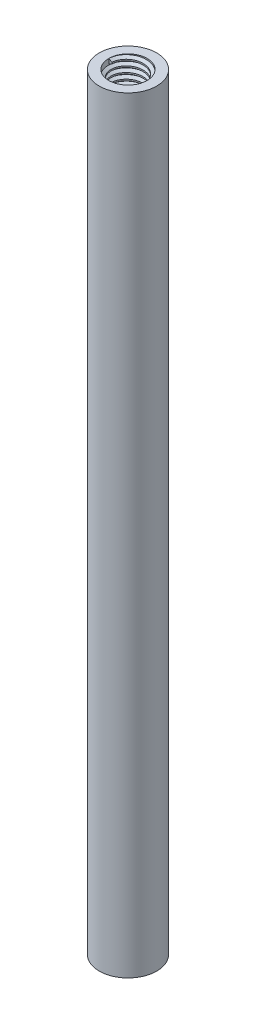
from build123d import *

# Parameters (mm, degrees)
SKETCH1_R           = 7.5
SKETCH1_R_2         = 5
BOSS_EXTRUDE1_DEPTH = 100
THREAD1_PITCH       = 1.5
THREAD2_PITCH       = 1.5


with BuildPart() as part:
    # Sketch1 → Boss-Extrude1 (new, symmetric)
    with BuildSketch(Plane(origin=(0, 0, 0), x_dir=(1, 0, 0), z_dir=(0, 1, 0))):
        with Locations(Location((0, 0, 0), (0, 0, 270))):
            Circle(SKETCH1_R)
        with Locations(Location((0, 0, 0), (0, 0, 270))):
            Circle(SKETCH1_R_2, mode=Mode.SUBTRACT)
    extrude(amount=BOSS_EXTRUDE1_DEPTH, both=True)

    # Thread1: arcs per turn and ends read off the stored shape
    # Thread1: the profile of Thread Profile1 profile screwed along a right-hand helix through 10 turns, 8 arcs to a turn; built about Z, then put on its axis
    thread1_z = Axis((0, 0, 0), (0, 0, 1))
    thread1_corners = [(5.0003, 0, -0.000173205), (5.0003, 0, 1.312673201), (4.188101187, 0, 0.843749998), (4.188101187, 0, 0.468749998)]
    with BuildLine(mode=Mode.PRIVATE) as thread1_profile:
        Line(thread1_corners[0], thread1_corners[1])
        Line(thread1_corners[1], thread1_corners[2])
        Line(thread1_corners[2], thread1_corners[3])
        Line(thread1_corners[3], thread1_corners[0])
    thread1_cap = Face(thread1_profile.wire())
    thread1_turn_angles = [0, 22.5, 45, 67.5, 90, 112.5, 135, 157.5, 180, 202.5, 225, 247.5, 270, 292.5, 315, 337.5, 360]
    thread1_turn_weights = [1, 0.9238795325112867, 1, 0.9238795325112867, 1, 0.9238795325112867, 1, 0.9238795325112867, 1, 0.9238795325112867, 1, 0.9238795325112867, 1, 0.9238795325112867, 1, 0.9238795325112867, 1]
    thread1_turn_rails = [Edge.make_bspline([Vector(p[0], p[1], 0).rotate(thread1_z, thread1_turn_angles[k]) / thread1_turn_weights[k] + Vector(0, 0, p[2] + THREAD1_PITCH * thread1_turn_angles[k] / 360) for k in range(17)], [0, 0, 0, 1, 1, 2, 2, 3, 3, 4, 4, 5, 5, 6, 6, 7, 7, 8, 8, 8], 2, thread1_turn_weights) for p in thread1_corners]
    thread1_turn_sides = [Face.make_surface_from_curves(thread1_turn_rails[p[0]], thread1_turn_rails[p[1]]) for p in [(0, 1), (1, 2), (2, 3), (3, 0)]]
    thread1 = Plane(origin=(0, 100, 0), x_dir=(-1, 0, 0), z_dir=(0, -1, 0)) * Solid(Shell([*[p.moved(Location((0, 0, THREAD1_PITCH * i))) for i in range(10) for p in thread1_turn_sides], thread1_cap, thread1_cap.rotate(thread1_z, 3600).moved(Location((0, 0, THREAD1_PITCH * 3600 / 360)))]))
    add(thread1)

    # Thread2: arcs per turn and ends read off the stored shape
    # Thread2: the profile of Thread Profile2 profile screwed along a right-hand helix through 10 turns, 8 arcs to a turn; built about Z, then put on its axis
    thread2_z = Axis((0, 0, 0), (0, 0, 1))
    thread2_corners = [(5.0003, 0, -0.000173205), (5.0003, 0, 1.312673201), (4.188101187, 0, 0.843749998), (4.188101187, 0, 0.468749998)]
    with BuildLine(mode=Mode.PRIVATE) as thread2_profile:
        Line(thread2_corners[0], thread2_corners[1])
        Line(thread2_corners[1], thread2_corners[2])
        Line(thread2_corners[2], thread2_corners[3])
        Line(thread2_corners[3], thread2_corners[0])
    thread2_cap = Face(thread2_profile.wire())
    thread2_turn_angles = [0, 22.5, 45, 67.5, 90, 112.5, 135, 157.5, 180, 202.5, 225, 247.5, 270, 292.5, 315, 337.5, 360]
    thread2_turn_weights = [1, 0.9238795325112867, 1, 0.9238795325112867, 1, 0.9238795325112867, 1, 0.9238795325112867, 1, 0.9238795325112867, 1, 0.9238795325112867, 1, 0.9238795325112867, 1, 0.9238795325112867, 1]
    thread2_turn_rails = [Edge.make_bspline([Vector(p[0], p[1], 0).rotate(thread2_z, thread2_turn_angles[k]) / thread2_turn_weights[k] + Vector(0, 0, p[2] + THREAD2_PITCH * thread2_turn_angles[k] / 360) for k in range(17)], [0, 0, 0, 1, 1, 2, 2, 3, 3, 4, 4, 5, 5, 6, 6, 7, 7, 8, 8, 8], 2, thread2_turn_weights) for p in thread2_corners]
    thread2_turn_sides = [Face.make_surface_from_curves(thread2_turn_rails[p[0]], thread2_turn_rails[p[1]]) for p in [(0, 1), (1, 2), (2, 3), (3, 0)]]
    thread2 = Plane(origin=(0, -100, 0), x_dir=(1, 0, 0), z_dir=(0, 1, 0)) * Solid(Shell([*[p.moved(Location((0, 0, THREAD2_PITCH * i))) for i in range(10) for p in thread2_turn_sides], thread2_cap, thread2_cap.rotate(thread2_z, 3600).moved(Location((0, 0, THREAD2_PITCH * 3600 / 360)))]))
    add(thread2)


solid = part.part
